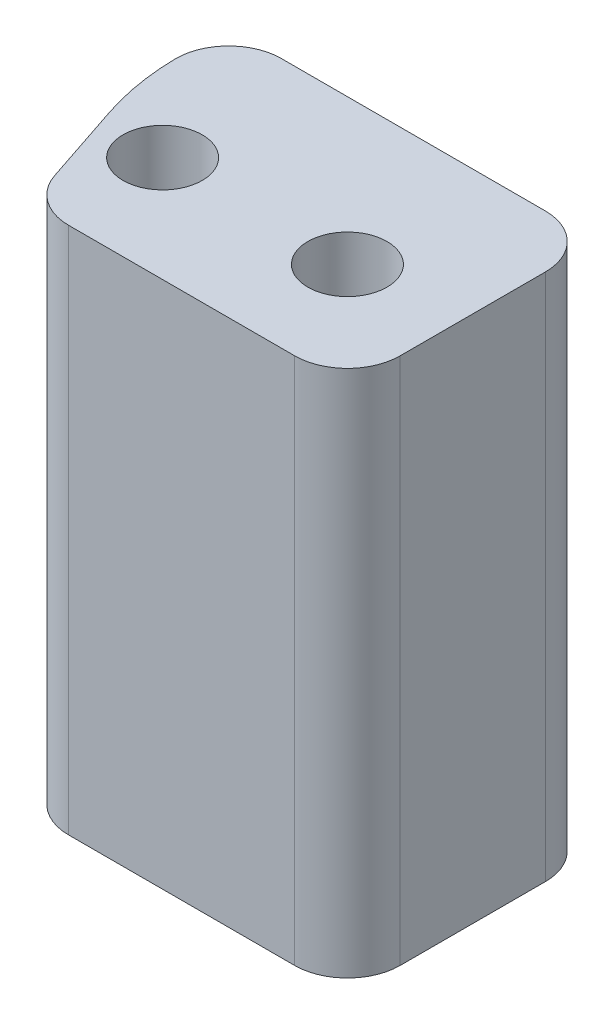
from build123d import *

# Parameters (mm, degrees)
SKETCH1_W           = 17.78
SKETCH1_H           = 12.065
SKETCH1_R           = 1.905
BOSS_EXTRUDE1_DEPTH = 25.4
CUT_EXTRUDE1_DEPTH  = 28.578672126
FILLET1_R           = 2.54
FILLET2_R           = 12.7


with BuildPart() as part:
    # Sketch1 → Boss-Extrude1 (new body)
    with BuildSketch(Plane(origin=(0, 0, 0), x_dir=(1, 0, 0), z_dir=(0, 1, 0))):
        Rectangle(SKETCH1_W, SKETCH1_H)
        with Locations(Location((-5.08, -0.9525, 0), (0, 0, 270))):
            Circle(SKETCH1_R, mode=Mode.SUBTRACT)
        with Locations(Location((3.81, -0.9525, 0), (0, 0, 90))):
            Circle(SKETCH1_R, mode=Mode.SUBTRACT)
    extrude(amount=BOSS_EXTRUDE1_DEPTH)

    # Sketch2 → Cut-Extrude1 (cut, through all)
    with BuildSketch(Plane(origin=(0, 25.4, 0), x_dir=(1, 0, 0), z_dir=(0, 1, 0))):
        Polygon((-8.89, 1.5875), (-6.35, -6.0325), (-8.89, -6.0325), align=None)
    extrude(amount=-CUT_EXTRUDE1_DEPTH, mode=Mode.SUBTRACT)

    # Fillet1
    fillet1_edges = [part.edges().sort_by_distance(p)[0] for p in [
        (-6.35, 12.7, 6.0325),
        (8.89, 12.7, 6.0325),
        (-8.89, 12.7, -6.0325),
        (8.89, 12.7, -6.0325),
    ]]
    fillet(fillet1_edges, radius=FILLET1_R)

    # Fillet2
    # the kernel refuses this fillet: 12.7 mm, written as the material it takes off along each edge
    with BuildSketch(Plane(origin=(-8.89, 30.542393541, -1.5875), x_dir=(0.00016823247484796397, 0, -0.9999999858489171), z_dir=(0, -1, 0))) as fillet2_piece_1:
        with BuildLine():
            CenterArc((2.066827795, 12.698397406), FILLET2_R, 251.555412166, 17.534355835)
            Line((-1.951291688, 0.650795328), (-2.353103637, -0.553964879))
            Line((-2.353103637, -0.553964879), (-0.401811948, -1.204760208))
            Line((-0.401811948, -1.204760208), (-0.000213655, -1.269999982))
            ThreePointArc((-0.000213655, -1.269999982), (1.904786318, -1.270320465), (1.844902092, -1.269839741))
            Line((1.844902092, -1.269839741), (1.865077156, 0))
        make_face()
    extrude(amount=35.684787082, mode=Mode.SUBTRACT)


solid = part.part
